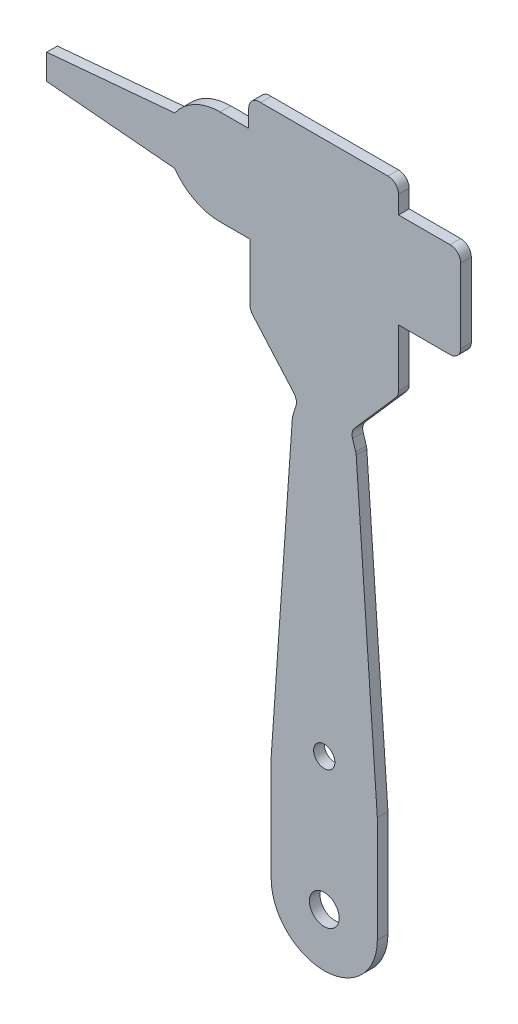
from build123d import *

# Parameters (mm, degrees)
MODEL_R           = 1
MODEL_R_2         = 1.4
BRIDA_BASE1_DEPTH = 1


# Sheet-metal steps are written as plain solids
with BuildPart() as part:
    # Model → Brida base1 (new body)
    with BuildSketch(Plane.XY):
        with BuildLine():
            Line((57.06109229, 44.40989684), (52.2059904, 44.40989684))
            Line((52.2059904, 44.40989684), (52.2059904, 46.085251303))
            ThreePointArc((52.2059904, 46.085251303), (51.913097181, 46.792358084), (51.2059904, 47.085251303))
            Line((51.2059904, 47.085251303), (39.2059904, 47.085251303))
            ThreePointArc((39.2059904, 47.085251303), (38.423096783, 46.836466455), (38.090692903, 46.085251454))
            Line((38.090692903, 46.085251454), (38.090692903, 44.40989684))
            Line((38.090692903, 44.40989684), (35.393347813, 44.40989684))
            ThreePointArc((35.393347813, 44.40989684), (32.986264566, 43.82101601), (31.122905732, 42.187392968))
            Line((31.122905732, 42.187392968), (19.054035234, 41.120549071))
            Line((19.054035234, 41.120549071), (19.054035234, 38.729385282))
            Line((19.054035234, 38.729385282), (31.122905732, 37.662541385))
            ThreePointArc((31.122905732, 37.662541385), (32.986264566, 36.028918342), (35.393347813, 35.440037512))
            Line((35.393347813, 35.440037512), (38.2059904, 35.440037512))
            Line((38.2059904, 35.440037512), (38.2059904, 30.049740987))
            ThreePointArc((38.2059904, 30.049740987), (38.270016908, 29.697670508), (38.453897645, 29.390683715))
            Line((38.453897645, 29.390683715), (42.336424948, 24.960081428))
            ThreePointArc((42.336424948, 24.960081428), (42.562673339, 24.508023196), (42.538911562, 24.0030674))
            Line((42.538911562, 24.0030674), (42.240856149, 23.048171958))
            ThreePointArc((42.240856149, 23.048171958), (42.212695742, 22.935208537), (42.197855138, 22.819737764))
            Line((42.197855138, 22.819737764), (40.2059904, -5.7615616))
            Line((40.2059904, -5.7615616), (40.2059904, -15.7615616))
            ThreePointArc((40.2059904, -15.7615616), (45.2059904, -20.7615616), (50.2059904, -15.7615616))
            Line((50.2059904, -15.7615616), (50.2059904, -5.7615616))
            Line((50.2059904, -5.7615616), (48.214125662, 22.819737764))
            ThreePointArc((48.214125662, 22.819737764), (48.199285058, 22.935208537), (48.171124651, 23.048171958))
            Line((48.171124651, 23.048171958), (47.873069238, 24.0030674))
            ThreePointArc((47.873069238, 24.0030674), (47.849307461, 24.508023196), (48.075555852, 24.960081428))
            Line((48.075555852, 24.960081428), (51.958083155, 29.390683715))
            ThreePointArc((51.958083155, 29.390683715), (52.141963892, 29.697670508), (52.2059904, 30.049740987))
            Line((52.2059904, 30.049740987), (52.2059904, 35.440037512))
            Line((52.2059904, 35.440037512), (57.06109229, 35.440037512))
            ThreePointArc((57.06109229, 35.440037512), (57.768199071, 35.732930731), (58.06109229, 36.440037513))
            Line((58.06109229, 36.440037513), (58.06109229, 43.40989684))
            ThreePointArc((58.06109229, 43.40989684), (57.768199071, 44.117003621), (57.06109229, 44.40989684))
        make_face()
        with Locations((45.2059904, -3.2615616)):
            Circle(MODEL_R, mode=Mode.SUBTRACT)
        with Locations((45.2059904, -15.7615616)):
            Circle(MODEL_R_2, mode=Mode.SUBTRACT)
    extrude(amount=-BRIDA_BASE1_DEPTH)


solid = part.part
